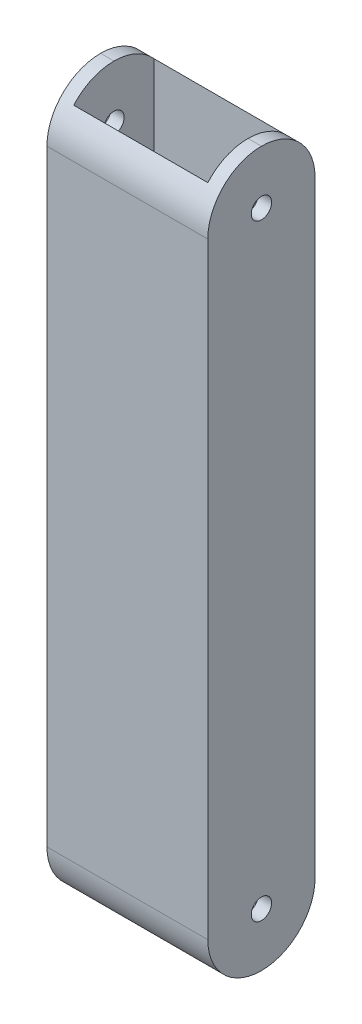
from build123d import *

# Parameters (mm, degrees)
SKETCH1_W               = 38.1
SKETCH1_H               = 25.4
SKETCH1_W_2             = 31.75
SKETCH1_H_2             = 19.05
BOSS_EXTRUDE1_DEPTH     = 169.106596
CUT_EXTRUDE1_DEPTH      = 174.810071085
CUT_EXTRUDE1_DEPTH_BACK = 174.810071085
SKETCH2_R               = 2.413
FILLET7_R               = 12.7


with BuildPart() as part:
    # Sketch1 → Boss-Extrude1 (new body)
    with BuildSketch(Plane(origin=(0, 0, 0), x_dir=(1, 0, 0), z_dir=(0, 1, 0))):
        Rectangle(SKETCH1_W, SKETCH1_H)
        Rectangle(SKETCH1_W_2, SKETCH1_H_2, mode=Mode.SUBTRACT)
    extrude(amount=BOSS_EXTRUDE1_DEPTH)

    # Sketch2 → Cut-Extrude1 (cut, two sides: drawn at the far end of the back side and taken through both)
    with BuildSketch(Plane(origin=(19.05, 0, 0), x_dir=(0, 0, -1), z_dir=(1, 0, 0)).offset(-CUT_EXTRUDE1_DEPTH_BACK)):
        with Locations((0, 156.406596)):
            Circle(SKETCH2_R)
        with Locations((0, 12.7)):
            Circle(SKETCH2_R)
    extrude(amount=CUT_EXTRUDE1_DEPTH + CUT_EXTRUDE1_DEPTH_BACK, mode=Mode.SUBTRACT)

    # Fillet7
    # the kernel refuses this fillet: 12.7 mm, written as the material it takes off along each edge
    with BuildSketch(Plane(origin=(50.8, 169.106596, -12.7), x_dir=(0, 0, 1), z_dir=(-1, 0, 0)), Plane(origin=(-50.8, 0, 12.7), x_dir=(0, 1, 0), z_dir=(1, 0, 0))) as fillet7_piece_1:
        with BuildLine():
            CenterArc((FILLET7_R, -FILLET7_R), FILLET7_R, 90, 90)
            Line((0, -FILLET7_R), (0, 0))
            Line((0, 0), (FILLET7_R, 0))
        make_face()
    extrude(amount=101.6, mode=Mode.SUBTRACT)
    with BuildSketch(Plane(origin=(50.8, 0, -12.7), x_dir=(0, 0, 1), z_dir=(-1, 0, 0)), Plane(origin=(-50.8, 169.106596, 12.7), x_dir=(0, -1, 0), z_dir=(1, 0, 0))) as fillet7_piece_2:
        with BuildLine():
            CenterArc((FILLET7_R, FILLET7_R), FILLET7_R, 180, 90)
            Line((0, FILLET7_R), (0, 0))
            Line((0, 0), (FILLET7_R, 0))
        make_face()
    extrude(amount=101.6, mode=Mode.SUBTRACT)


solid = part.part
